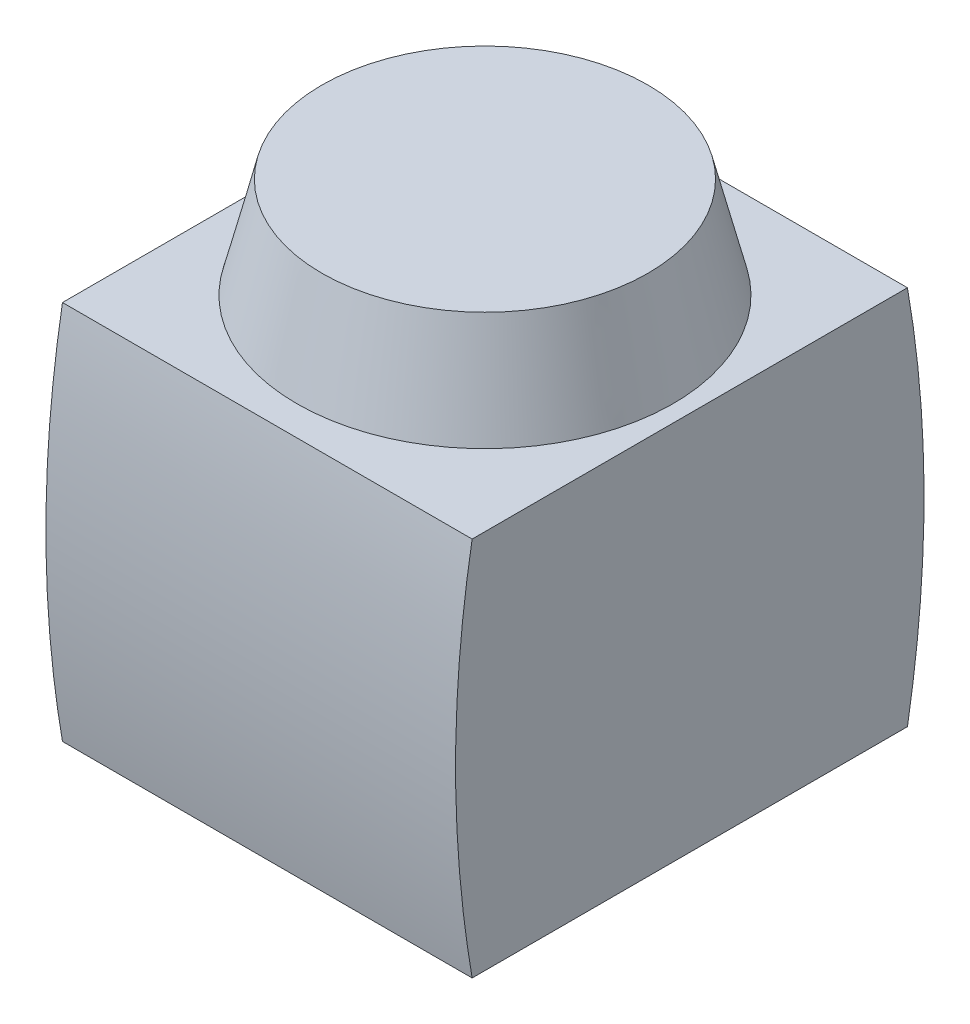
from build123d import *

# Parameters (mm, degrees)
BOSS_EXTRUDE1_DEPTH      = 1.04
BOSS_EXTRUDE1_DEPTH_BACK = 1.04
SKETCH2_R                = 0.955
BOSS_EXTRUDE2_DEPTH      = 0.51
BOSS_EXTRUDE2_TAPER      = 14


with BuildPart() as part:
    # Sketch1 → Boss-Extrude1 (new, two sides: drawn at the far end of the back side and taken through both)
    with BuildSketch(Plane(origin=(0, 0, 0), x_dir=(0, 0, -1), z_dir=(1, 0, 0)).offset(-BOSS_EXTRUDE1_DEPTH_BACK)):
        with BuildLine():
            Line((-1.105, -0.965), (1.105, -0.965))
            add(Edge.make_bspline(
                [(1.105, 0.965), (1.273333661, 0.009409903), (1.105, -0.965)],
                knots=[0, 0, 0, 1, 1, 1], degree=2))
            Line((1.105, 0.965), (-1.105, 0.965))
            add(Edge.make_bspline(
                [(-1.105, 0.965), (-1.273333661, 0.009409903), (-1.105, -0.965)],
                knots=[0, 0, 0, 1, 1, 1], degree=2))
        make_face()
    extrude(amount=BOSS_EXTRUDE1_DEPTH + BOSS_EXTRUDE1_DEPTH_BACK)

    # Sketch2 → Boss-Extrude2 (add)
    with BuildSketch(Plane(origin=(0, 0.965, 0), x_dir=(1, 0, 0), z_dir=(0, 1, 0))):
        Circle(SKETCH2_R)
    extrude(amount=BOSS_EXTRUDE2_DEPTH, taper=BOSS_EXTRUDE2_TAPER)


solid = part.part
